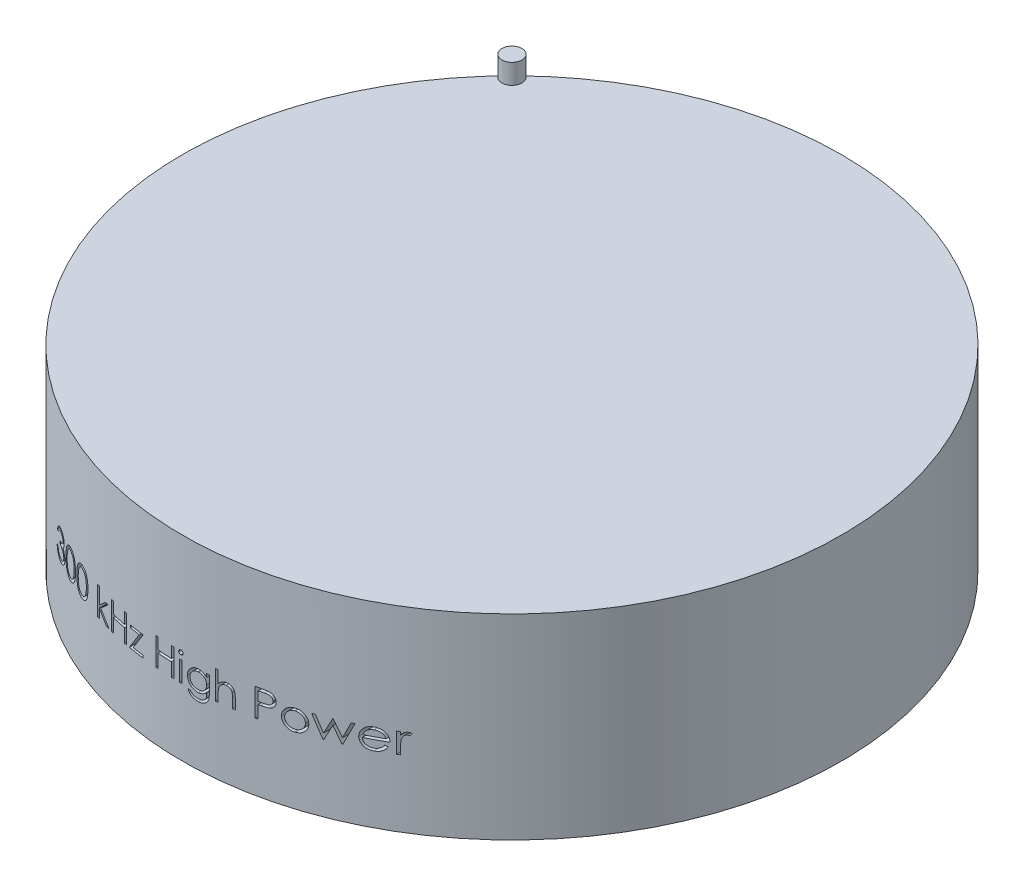
from build123d import *

# Parameters (mm, degrees)
SKETCH1_W          = 41.90000002
SKETCH1_H          = 24.892
SKETCH2_W          = 1.27
SKETCH2_H          = 2.54
CUT_EXTRUDE1_START = 43.18
SKETCH3_W          = 0.314102565
SKETCH3_H          = 2.557692308
CUT_EXTRUDE1_DEPTH = 12.7


with BuildPart() as part:
    # Sketch1 → Revolve1 (revolve)
    with BuildSketch(Plane.XY):
        with Locations((20.95000001, 12.446)):
            Rectangle(SKETCH1_W, SKETCH1_H)
    revolve(axis=Axis((0, 0, 0), (0, 1, 0)))

    # Sketch3 → Cut-Extrude1 (cut)
    # profile 1 of 16: a face of its own
    with BuildSketch(Plane.XY.offset(CUT_EXTRUDE1_START)):
        with BuildLine():
            Line((-21.96474359, 11.216218413), (-22.278846154, 11.216218413))
            add(Edge.make_bspline(
                [(-22.278846154, 11.216218413), (-22.270336603, 11.251450897), (-22.253701128, 11.320327521), (-22.219003554, 11.418734782), (-22.181204299, 11.511858303), (-22.135815194, 11.597954377), (-22.08630644, 11.67875328), (-22.029583719, 11.752422404), (-21.968263996, 11.82083537), (-21.900439047, 11.881548607), (-21.829310385, 11.936526336), (-21.753875765, 11.983401394), (-21.675652872, 12.023725547), (-21.594099739, 12.056945778), (-21.508973567, 12.081971302), (-21.421043944, 12.100128108), (-21.330080444, 12.111919222), (-21.268332853, 12.113069985), (-21.236979167, 12.11365431)],
                knots=[0, 0, 0, 0, 1.162005537, 2.271625781, 3.343758855, 4.383309926, 5.390229558, 6.379919256, 7.361854164, 8.333198761, 9.295911338, 10.242430842, 11.177959212, 12.116337295, 13.062827104, 14.020064771, 14.994644689, 16, 16, 16, 16], degree=3))
            add(Edge.make_bspline(
                [(-21.236979167, 12.11365431), (-21.191296425, 12.11227508), (-21.100927414, 12.109546704), (-20.968164367, 12.084632268), (-20.840137548, 12.045207135), (-20.7182483, 11.990733408), (-20.605029867, 11.923546095), (-20.50429368, 11.843581358), (-20.41740517, 11.752382057), (-20.344510792, 11.651649492), (-20.287435793, 11.543993983), (-20.245349419, 11.433193826), (-20.219727738, 11.319511855), (-20.216407182, 11.242754575), (-20.21474359, 11.204299342)],
                knots=[0, 0, 0, 0, 1.083050992, 2.142477498, 3.193116406, 4.255571735, 5.30263384, 6.308962982, 7.297363603, 8.282367274, 9.249857812, 10.179914175, 11.08814088, 12, 12, 12, 12], degree=3))
            add(Edge.make_bspline(
                [(-20.21474359, 11.204299342), (-20.215907181, 11.167292547), (-20.218184148, 11.094875993), (-20.237517853, 10.989154496), (-20.270054116, 10.889512895), (-20.315123879, 10.795531733), (-20.373465429, 10.707806894), (-20.444138126, 10.626141003), (-20.527640788, 10.550171845), (-20.590919726, 10.506652372), (-20.623497596, 10.484247259)],
                knots=[0, 0, 0, 0, 1.024540389, 2.004866551, 2.965041327, 3.920577974, 4.882998113, 5.874504559, 6.905732034, 8, 8, 8, 8], degree=3))
            add(Edge.make_bspline(
                [(-20.623497596, 10.484247259), (-20.586265842, 10.466269087), (-20.512498967, 10.43064913), (-20.411948438, 10.360793372), (-20.320670562, 10.280137025), (-20.269766843, 10.217194372), (-20.244190705, 10.185569374)],
                knots=[0, 0, 0, 0, 1.015518401, 2.012035669, 3.001164323, 4, 4, 4, 4], degree=3))
            add(Edge.make_bspline(
                [(-20.244190705, 10.185569374), (-20.227349363, 10.162511623), (-20.193942467, 10.116773706), (-20.152706933, 10.04323728), (-20.115297819, 9.968885791), (-20.086147599, 9.891726385), (-20.063573732, 9.812653371), (-20.0474377, 9.731530975), (-20.037413559, 9.648292953), (-20.035978007, 9.591980472), (-20.03525641, 9.563674342)],
                knots=[0, 0, 0, 0, 1.025084078, 2.033381695, 3.024893161, 4.013698104, 4.991890475, 5.976764909, 6.982997093, 8, 8, 8, 8], degree=3))
            add(Edge.make_bspline(
                [(-20.03525641, 9.563674342), (-20.037050924, 9.514664621), (-20.040631506, 9.416875819), (-20.07263558, 9.272401097), (-20.122248821, 9.131175595), (-20.192705757, 8.996100756), (-20.278573266, 8.869720375), (-20.38073059, 8.756644066), (-20.498016998, 8.659445462), (-20.628822647, 8.578235233), (-20.770539776, 8.513317311), (-20.922115368, 8.468259868), (-21.081365421, 8.438913869), (-21.190572719, 8.435767), (-21.24609375, 8.434167131)],
                knots=[0, 0, 0, 0, 0.955779014, 1.907060117, 2.875433937, 3.871313158, 4.872415639, 5.851225146, 6.836215519, 7.83643374, 8.849228613, 9.86973379, 10.916971861, 12, 12, 12, 12], degree=3))
            add(Edge.make_bspline(
                [(-21.24609375, 8.434167131), (-21.28351305, 8.435035344), (-21.357141755, 8.436743698), (-21.465385254, 8.448422299), (-21.568706953, 8.469752304), (-21.667246551, 8.49845561), (-21.761091587, 8.534847352), (-21.849955693, 8.58016605), (-21.934385586, 8.633477552), (-22.013584537, 8.69541114), (-22.087543105, 8.764692479), (-22.154295829, 8.842551489), (-22.214955622, 8.927548893), (-22.267898261, 9.02067195), (-22.315535213, 9.120717207), (-22.35471617, 9.228965705), (-22.389201739, 9.344449727), (-22.405235203, 9.424927467), (-22.413461538, 9.466218413)],
                knots=[0, 0, 0, 0, 1.048658725, 2.063410685, 3.046034179, 4.001477787, 4.936774919, 5.862367409, 6.792675028, 7.730719943, 8.675894397, 9.627829632, 10.600096036, 11.597688215, 12.626045268, 13.701542398, 14.82072376, 16, 16, 16, 16], degree=3))
            Line((-22.413461538, 9.466218413), (-22.099358974, 9.466218413))
            add(Edge.make_bspline(
                [(-22.099358974, 9.466218413), (-22.091175683, 9.439269399), (-22.07525847, 9.386851228), (-22.048164172, 9.311410922), (-22.0172959, 9.242252869), (-21.984181342, 9.178869747), (-21.949402895, 9.120637344), (-21.91048797, 9.069095475), (-21.870318825, 9.021980273), (-21.840039472, 8.995435661), (-21.825220353, 8.982444374)],
                knots=[0, 0, 0, 0, 1.198163088, 2.33053128, 3.407730985, 4.417276592, 5.372219308, 6.28897303, 7.162600585, 8, 8, 8, 8], degree=3))
            add(Edge.make_bspline(
                [(-21.825220353, 8.982444374), (-21.805623776, 8.96733604), (-21.766491113, 8.937166008), (-21.702722882, 8.89866438), (-21.635657996, 8.865303355), (-21.563843322, 8.839819659), (-21.488828551, 8.818241998), (-21.409401186, 8.804121479), (-21.326261969, 8.794433308), (-21.269494205, 8.793578376), (-21.240484776, 8.79314149)],
                knots=[0, 0, 0, 0, 0.946170439, 1.889420265, 2.845303464, 3.807233317, 4.801018734, 5.828864929, 6.890507805, 8, 8, 8, 8], degree=3))
            add(Edge.make_bspline(
                [(-21.240484776, 8.79314149), (-21.207731273, 8.793757395), (-21.143684626, 8.794961744), (-21.050229767, 8.806037451), (-20.961322319, 8.822167865), (-20.877949393, 8.847080847), (-20.799018886, 8.877861699), (-20.725637236, 8.916510104), (-20.65684113, 8.961854826), (-20.593511725, 9.013393985), (-20.536566217, 9.06981548), (-20.486426704, 9.128828551), (-20.443802043, 9.19018438), (-20.409418464, 9.254222501), (-20.382267914, 9.32067773), (-20.363784714, 9.389736559), (-20.350933198, 9.460833826), (-20.349886586, 9.509162795), (-20.349358974, 9.533526105)],
                knots=[0, 0, 0, 0, 1.217147791, 2.380027433, 3.494444702, 4.572153297, 5.609568379, 6.639424714, 7.649109417, 8.668170816, 9.669597737, 10.625200337, 11.543417969, 12.441394052, 13.322311151, 14.205496177, 15.095365482, 16, 16, 16, 16], degree=3))
            add(Edge.make_bspline(
                [(-20.349358974, 9.533526105), (-20.350889276, 9.566137444), (-20.353942264, 9.631197852), (-20.377250844, 9.726915426), (-20.415589708, 9.819138839), (-20.469262219, 9.906294629), (-20.534597948, 9.98707053), (-20.610962855, 10.059142013), (-20.698991083, 10.118612104), (-20.780010952, 10.15970076), (-20.851776109, 10.187737835), (-20.913191493, 10.2064128), (-20.981948097, 10.222226456), (-21.057214445, 10.236938727), (-21.139557662, 10.249460075), (-21.2288881, 10.259901891), (-21.325223861, 10.268256932), (-21.391915027, 10.271988027), (-21.426282051, 10.27391072)],
                knots=[0, 0, 0, 0, 1.07054697, 2.135767047, 3.216561865, 4.33974944, 5.486079747, 6.621378074, 7.775625952, 8.963672916, 9.598146892, 10.304877434, 11.070270905, 11.915000392, 12.823868403, 13.805723172, 14.86925407, 16, 16, 16, 16], degree=3))
            Line((-21.426282051, 10.27391072), (-21.426282051, 10.632885079))
            add(Edge.make_bspline(
                [(-21.426282051, 10.632885079), (-21.382980886, 10.633619883), (-21.298164539, 10.635059183), (-21.174270234, 10.652467193), (-21.055796922, 10.676547821), (-20.94537018, 10.713433014), (-20.844721467, 10.756273311), (-20.757401865, 10.80612552), (-20.684634717, 10.861540269), (-20.626773646, 10.923372879), (-20.583244417, 10.989687926), (-20.55141762, 11.058804584), (-20.532617294, 11.131328645), (-20.530107627, 11.180823313), (-20.528846154, 11.205701586)],
                knots=[0, 0, 0, 0, 1.321986639, 2.589447074, 3.816329219, 5.01088745, 6.139805852, 7.153945165, 8.075214402, 8.924034688, 9.728124013, 10.488707548, 11.240355623, 12, 12, 12, 12], degree=3))
            add(Edge.make_bspline(
                [(-20.528846154, 11.205701586), (-20.529260565, 11.223979331), (-20.530085016, 11.260342038), (-20.540482294, 11.313467107), (-20.556106335, 11.364968053), (-20.577586064, 11.414625863), (-20.606336263, 11.462096137), (-20.640742249, 11.507783586), (-20.681710349, 11.551427365), (-20.728655796, 11.592107684), (-20.779067601, 11.630876921), (-20.834317376, 11.663790558), (-20.892739251, 11.69193562), (-20.954397906, 11.715145122), (-21.019493436, 11.732604411), (-21.087719994, 11.745140252), (-21.159207677, 11.752977907), (-21.207979409, 11.754106323), (-21.232772436, 11.754679951)],
                knots=[0, 0, 0, 0, 0.884392785, 1.759457502, 2.611959086, 3.489218968, 4.37281399, 5.2945488, 6.255912374, 7.266815255, 8.301784654, 9.332968512, 10.37626691, 11.440494194, 12.520033166, 13.637162961, 14.798855837, 16, 16, 16, 16], degree=3))
            add(Edge.make_bspline(
                [(-21.232772436, 11.754679951), (-21.272624104, 11.753288589), (-21.35046368, 11.750570935), (-21.462678597, 11.726767922), (-21.566997931, 11.688789839), (-21.646736598, 11.643456819), (-21.705619172, 11.598706385), (-21.74769611, 11.559623999), (-21.789016621, 11.516191175), (-21.826862297, 11.4657328), (-21.865136274, 11.41166601), (-21.899980836, 11.351242328), (-21.933840528, 11.286037934), (-21.954243077, 11.239942299), (-21.96474359, 11.216218413)],
                knots=[0, 0, 0, 0, 1.472543308, 2.876219568, 4.221790263, 5.565193594, 6.249813518, 6.953379497, 7.687249741, 8.463570142, 9.283606569, 10.136032583, 11.040678096, 12, 12, 12, 12], degree=3))
        make_face()
    # profile 2 of 16: a face of its own
    with BuildSketch(Plane.XY.offset(CUT_EXTRUDE1_START)):
        with BuildLine():
            add(Edge.make_bspline(
                [(-19.721153846, 10.272508477), (-19.720825828, 10.328605864), (-19.720188648, 10.437575849), (-19.713100227, 10.596360491), (-19.701324885, 10.74532078), (-19.685187512, 10.884463846), (-19.665549532, 11.01382561), (-19.639334045, 11.133060367), (-19.609521242, 11.242719974), (-19.574968797, 11.343162023), (-19.535981008, 11.435739726), (-19.493546747, 11.522164927), (-19.445981952, 11.602306859), (-19.39600504, 11.67744465), (-19.341592968, 11.746348344), (-19.284294177, 11.809991007), (-19.221872301, 11.866901757), (-19.156449293, 11.91874806), (-19.087432829, 11.964197531), (-19.016790162, 12.00423027), (-18.944035057, 12.038430137), (-18.868968874, 12.065320573), (-18.792266316, 12.08753142), (-18.713659249, 12.102720368), (-18.633017885, 12.112277276), (-18.57858645, 12.113190944), (-18.550981571, 12.11365431)],
                knots=[0, 0, 0, 0, 1.646270934, 3.197905019, 4.663502075, 6.030701355, 7.308322542, 8.50163776, 9.611534131, 10.641858119, 11.616356847, 12.558055219, 13.465016945, 14.349605745, 15.204443733, 16.039544428, 16.859896111, 17.680448484, 18.487036065, 19.28249412, 20.06191084, 20.843045899, 21.620316918, 22.403196591, 23.190181807, 24, 24, 24, 24], degree=3))
            add(Edge.make_bspline(
                [(-18.550981571, 12.11365431), (-18.523146092, 12.113166495), (-18.467790083, 12.112196384), (-18.385949708, 12.102872441), (-18.306000026, 12.087401318), (-18.228281887, 12.065480344), (-18.152156901, 12.038284667), (-18.078220493, 12.00419755), (-18.006013412, 11.964518683), (-17.936683124, 11.917894805), (-17.869468509, 11.865912529), (-17.806020546, 11.80714986), (-17.74633346, 11.742200141), (-17.689658155, 11.671758277), (-17.637602557, 11.594473192), (-17.588029125, 11.511689083), (-17.543657089, 11.421958218), (-17.500922414, 11.32677775), (-17.464035427, 11.223514091), (-17.430769182, 11.112749331), (-17.403890213, 10.993175144), (-17.381500941, 10.865418898), (-17.364156045, 10.729011415), (-17.351523403, 10.5842451), (-17.344850318, 10.431024709), (-17.343593617, 10.32626686), (-17.342948718, 10.272508477)],
                knots=[0, 0, 0, 0, 0.810914788, 1.612654377, 2.396697861, 3.181598691, 3.963628158, 4.749916497, 5.551656086, 6.361998678, 7.18212741, 8.025565596, 8.878627764, 9.750805457, 10.657531673, 11.591944965, 12.560506719, 13.57287815, 14.630710178, 15.753379473, 16.941251878, 18.199788006, 19.531962791, 20.947069417, 22.433333509, 24, 24, 24, 24], degree=3))
            add(Edge.make_bspline(
                [(-17.342948718, 10.272508477), (-17.343600302, 10.218984569), (-17.344869888, 10.114695417), (-17.351448595, 9.962164442), (-17.364407226, 9.818166398), (-17.380617215, 9.682355936), (-17.403068178, 9.555298317), (-17.430673344, 9.436553869), (-17.461323667, 9.325609797), (-17.499158461, 9.223374985), (-17.540569171, 9.128423262), (-17.585624367, 9.039756114), (-17.633894193, 8.956589821), (-17.686482938, 8.879590074), (-17.742536352, 8.808211417), (-17.80325414, 8.743713795), (-17.866924726, 8.684543123), (-17.934337141, 8.631891495), (-18.004748693, 8.585806691), (-18.07670777, 8.54459284), (-18.151491153, 8.511360145), (-18.227404106, 8.482825104), (-18.305532472, 8.461024652), (-18.385778862, 8.445950797), (-18.467735098, 8.435378948), (-18.523136663, 8.434572468), (-18.550981571, 8.434167131)],
                knots=[0, 0, 0, 0, 1.561518951, 3.042555995, 4.452378317, 5.7783523, 7.031515105, 8.214008947, 9.334062868, 10.386615937, 11.391082383, 12.354592575, 13.286541444, 14.194233754, 15.072674879, 15.931287219, 16.775624067, 17.606195743, 18.42308326, 19.229000347, 20.022332153, 20.807536673, 21.593273796, 22.3848459, 23.188221202, 24, 24, 24, 24], degree=3))
            add(Edge.make_bspline(
                [(-18.550981571, 8.434167131), (-18.578585684, 8.434633486), (-18.633015609, 8.435553048), (-18.713668035, 8.445066779), (-18.791950478, 8.460362283), (-18.868249232, 8.481778887), (-18.942955747, 8.507993723), (-19.015052034, 8.542147407), (-19.085339718, 8.581481476), (-19.153631274, 8.626276897), (-19.218643435, 8.67759858), (-19.28074204, 8.734362869), (-19.338367059, 8.79798628), (-19.392001155, 8.867464203), (-19.442975243, 8.942157446), (-19.489864616, 9.023085819), (-19.53323547, 9.109928429), (-19.572878961, 9.20324634), (-19.608027624, 9.304401268), (-19.639075333, 9.414550446), (-19.66358949, 9.534666082), (-19.684572445, 9.663783449), (-19.701496828, 9.80245738), (-19.713051154, 9.950763158), (-19.720192469, 10.108608367), (-19.720827539, 10.216878141), (-19.721153846, 10.272508477)],
                knots=[0, 0, 0, 0, 0.810891512, 1.598919785, 2.382837074, 3.152667961, 3.926044502, 4.706494248, 5.493654104, 6.291793342, 7.103789334, 7.925228297, 8.761435821, 9.622817696, 10.50288917, 11.416980706, 12.369136599, 13.353924996, 14.394355917, 15.514179734, 16.714354668, 17.994756427, 19.357759367, 20.818452758, 22.365282078, 24, 24, 24, 24], degree=3))
        make_face()
        with BuildLine():
            add(Edge.make_bspline(
                [(-19.407051282, 10.27391072), (-19.406931835, 10.227162021), (-19.406700012, 10.136431977), (-19.400643811, 10.004588716), (-19.392393579, 9.881618387), (-19.381752282, 9.76736485), (-19.365949333, 9.662214838), (-19.348242546, 9.565445155), (-19.326694456, 9.477567918), (-19.301199438, 9.397980107), (-19.272160341, 9.325331039), (-19.240454478, 9.257729823), (-19.206393755, 9.194377887), (-19.168274604, 9.135844279), (-19.126759541, 9.081938115), (-19.082786282, 9.031705282), (-19.034713697, 8.986908301), (-18.968209955, 8.933181446), (-18.88041348, 8.877662312), (-18.769793025, 8.829316222), (-18.656124574, 8.798933766), (-18.578973324, 8.79507001), (-18.540464744, 8.79314149)],
                knots=[0, 0, 0, 0, 1.459021318, 2.831673884, 4.118529203, 5.306027144, 6.411944654, 7.436330062, 8.375795394, 9.233974572, 10.042671642, 10.816086306, 11.563610507, 12.285937304, 12.993564865, 13.685989202, 14.367179055, 15.041617293, 16.353048772, 17.594441528, 18.799311195, 20, 20, 20, 20], degree=3))
            add(Edge.make_bspline(
                [(-18.540464744, 8.79314149), (-18.501707072, 8.79473927), (-18.424271749, 8.797931533), (-18.311137954, 8.82873027), (-18.201307684, 8.87519981), (-18.115235743, 8.930147315), (-18.0497532, 8.982475645), (-18.00283621, 9.027090293), (-17.959774161, 9.07704616), (-17.918932086, 9.130945456), (-17.881473011, 9.189817941), (-17.847409873, 9.253380516), (-17.816326525, 9.321809694), (-17.798617479, 9.369579433), (-17.789563301, 9.394002868)],
                knots=[0, 0, 0, 0, 1.353760809, 2.704726607, 4.075137775, 5.516104923, 6.260822281, 7.007110065, 7.778089737, 8.566572457, 9.372053459, 10.217411131, 11.088608312, 12, 12, 12, 12], degree=3))
            add(Edge.make_bspline(
                [(-17.789563301, 9.394002868), (-17.779011533, 9.425232607), (-17.75758692, 9.488642371), (-17.729975145, 9.587006024), (-17.708229746, 9.690208787), (-17.68866638, 9.797633904), (-17.675313325, 9.910073605), (-17.664565511, 10.027179989), (-17.658234824, 10.149041351), (-17.657450073, 10.231836343), (-17.657051282, 10.27391072)],
                knots=[0, 0, 0, 0, 0.884706709, 1.796334032, 2.740027952, 3.714592787, 4.726048262, 5.777819803, 6.87074269, 8, 8, 8, 8], degree=3))
            add(Edge.make_bspline(
                [(-17.657051282, 10.27391072), (-17.657601471, 10.315978293), (-17.658677759, 10.398271458), (-17.662791747, 10.518789638), (-17.673415321, 10.633257399), (-17.68521444, 10.742167872), (-17.702611661, 10.844918175), (-17.721369468, 10.94236848), (-17.74657068, 11.033311505), (-17.773490455, 11.119171086), (-17.804300851, 11.198971741), (-17.838216585, 11.273085527), (-17.874438344, 11.341870252), (-17.913780584, 11.405137193), (-17.955776267, 11.463169736), (-18.001533817, 11.514804331), (-18.049238189, 11.561641299), (-18.116055375, 11.615103868), (-18.203529665, 11.669615564), (-18.312375312, 11.719781324), (-18.425645957, 11.748589616), (-18.502219411, 11.752651303), (-18.540464744, 11.754679951)],
                knots=[0, 0, 0, 0, 1.31362396, 2.569729283, 3.763502607, 4.902122613, 5.988968491, 7.01645872, 7.998833611, 8.933434873, 9.825090667, 10.667526885, 11.477055099, 12.250526234, 12.991942729, 13.710640831, 14.402115721, 15.076753259, 16.378508321, 17.609869233, 18.806226677, 20, 20, 20, 20], degree=3))
            add(Edge.make_bspline(
                [(-18.540464744, 11.754679951), (-18.579175336, 11.752648504), (-18.656667041, 11.74858191), (-18.771114996, 11.719888657), (-18.880819348, 11.669875691), (-18.968062322, 11.614923318), (-19.034926109, 11.562585007), (-19.082008802, 11.517198553), (-19.126154974, 11.467552298), (-19.166822675, 11.413150384), (-19.204911958, 11.354685016), (-19.23989297, 11.291696252), (-19.2714103, 11.223864887), (-19.300494836, 11.151248452), (-19.326067624, 11.071667507), (-19.347161587, 10.983898514), (-19.366648641, 10.887436622), (-19.380443909, 10.781717114), (-19.392707665, 10.667434961), (-19.400589013, 10.544157643), (-19.406720271, 10.412093262), (-19.406938735, 10.320894104), (-19.407051282, 10.27391072)],
                knots=[0, 0, 0, 0, 1.207732386, 2.417664972, 3.655092373, 4.956220595, 5.625982001, 6.301752483, 6.994047911, 7.697131622, 8.419323945, 9.170223765, 9.943494443, 10.752040957, 11.610060368, 12.549350801, 13.567764191, 14.679664412, 15.874934091, 17.154273443, 18.533957287, 20, 20, 20, 20], degree=3))
        make_face(mode=Mode.SUBTRACT)
    # profile 3 of 16: a face of its own
    with BuildSketch(Plane.XY.offset(CUT_EXTRUDE1_START)):
        with BuildLine():
            add(Edge.make_bspline(
                [(-17.028846154, 10.272508477), (-17.028518136, 10.328605864), (-17.027880956, 10.437575849), (-17.020792535, 10.596360491), (-17.009017192, 10.74532078), (-16.99287982, 10.884463846), (-16.973241839, 11.01382561), (-16.947026353, 11.133060367), (-16.91721355, 11.242719974), (-16.882661104, 11.343162023), (-16.843673315, 11.435739726), (-16.801239055, 11.522164927), (-16.75367426, 11.602306859), (-16.703697347, 11.67744465), (-16.649285276, 11.746348344), (-16.591986485, 11.809991007), (-16.529564609, 11.866901757), (-16.464141601, 11.91874806), (-16.395125136, 11.964197531), (-16.32448247, 12.00423027), (-16.251727364, 12.038430137), (-16.176661181, 12.065320573), (-16.099958623, 12.08753142), (-16.021351557, 12.102720368), (-15.940710193, 12.112277276), (-15.886278758, 12.113190944), (-15.858673878, 12.11365431)],
                knots=[0, 0, 0, 0, 1.646270934, 3.197905019, 4.663502075, 6.030701355, 7.308322542, 8.50163776, 9.611534131, 10.641858119, 11.616356847, 12.558055219, 13.465016945, 14.349605745, 15.204443733, 16.039544428, 16.859896111, 17.680448484, 18.487036065, 19.28249412, 20.06191084, 20.843045899, 21.620316918, 22.403196591, 23.190181807, 24, 24, 24, 24], degree=3))
            add(Edge.make_bspline(
                [(-15.858673878, 12.11365431), (-15.8308384, 12.113166495), (-15.775482391, 12.112196384), (-15.693642016, 12.102872441), (-15.613692334, 12.087401318), (-15.535974195, 12.065480344), (-15.459849209, 12.038284667), (-15.385912801, 12.00419755), (-15.313705719, 11.964518683), (-15.244375432, 11.917894805), (-15.177160817, 11.865912529), (-15.113712854, 11.80714986), (-15.054025768, 11.742200141), (-14.997350462, 11.671758277), (-14.945294865, 11.594473192), (-14.895721433, 11.511689083), (-14.851349397, 11.421958218), (-14.808614722, 11.32677775), (-14.771727735, 11.223514091), (-14.73846149, 11.112749331), (-14.711582521, 10.993175144), (-14.689193249, 10.865418898), (-14.671848353, 10.729011415), (-14.659215711, 10.5842451), (-14.652542626, 10.431024709), (-14.651285925, 10.32626686), (-14.650641026, 10.272508477)],
                knots=[0, 0, 0, 0, 0.810914788, 1.612654377, 2.396697861, 3.181598691, 3.963628158, 4.749916497, 5.551656086, 6.361998678, 7.18212741, 8.025565596, 8.878627764, 9.750805457, 10.657531673, 11.591944965, 12.560506719, 13.57287815, 14.630710178, 15.753379473, 16.941251878, 18.199788006, 19.531962791, 20.947069417, 22.433333509, 24, 24, 24, 24], degree=3))
            add(Edge.make_bspline(
                [(-14.650641026, 10.272508477), (-14.65129261, 10.218984569), (-14.652562196, 10.114695417), (-14.659140903, 9.962164442), (-14.672099534, 9.818166398), (-14.688309522, 9.682355936), (-14.710760485, 9.555298317), (-14.738365652, 9.436553869), (-14.769015974, 9.325609797), (-14.806850769, 9.223374985), (-14.848261479, 9.128423262), (-14.893316675, 9.039756114), (-14.941586501, 8.956589821), (-14.994175246, 8.879590074), (-15.050228659, 8.808211417), (-15.110946448, 8.743713795), (-15.174617033, 8.684543123), (-15.242029449, 8.631891495), (-15.312441, 8.585806691), (-15.384400077, 8.54459284), (-15.459183461, 8.511360145), (-15.535096413, 8.482825104), (-15.613224779, 8.461024652), (-15.69347117, 8.445950797), (-15.775427406, 8.435378948), (-15.830828971, 8.434572468), (-15.858673878, 8.434167131)],
                knots=[0, 0, 0, 0, 1.561518951, 3.042555995, 4.452378317, 5.7783523, 7.031515105, 8.214008947, 9.334062868, 10.386615937, 11.391082383, 12.354592575, 13.286541444, 14.194233754, 15.072674879, 15.931287219, 16.775624067, 17.606195743, 18.42308326, 19.229000347, 20.022332153, 20.807536673, 21.593273796, 22.3848459, 23.188221202, 24, 24, 24, 24], degree=3))
            add(Edge.make_bspline(
                [(-15.858673878, 8.434167131), (-15.886277992, 8.434633486), (-15.940707917, 8.435553048), (-16.021360342, 8.445066779), (-16.099642786, 8.460362283), (-16.17594154, 8.481778887), (-16.250648055, 8.507993723), (-16.322744342, 8.542147407), (-16.393032025, 8.581481476), (-16.461323581, 8.626276897), (-16.526335742, 8.67759858), (-16.588434348, 8.734362869), (-16.646059367, 8.79798628), (-16.699693462, 8.867464203), (-16.750667551, 8.942157446), (-16.797556924, 9.023085819), (-16.840927778, 9.109928429), (-16.880571269, 9.20324634), (-16.915719932, 9.304401268), (-16.94676764, 9.414550446), (-16.971281798, 9.534666082), (-16.992264753, 9.663783449), (-17.009189136, 9.80245738), (-17.020743461, 9.950763158), (-17.027884776, 10.108608367), (-17.028519847, 10.216878141), (-17.028846154, 10.272508477)],
                knots=[0, 0, 0, 0, 0.810891512, 1.598919785, 2.382837074, 3.152667961, 3.926044502, 4.706494248, 5.493654104, 6.291793342, 7.103789334, 7.925228297, 8.761435821, 9.622817696, 10.50288917, 11.416980706, 12.369136599, 13.353924996, 14.394355917, 15.514179734, 16.714354668, 17.994756427, 19.357759367, 20.818452758, 22.365282078, 24, 24, 24, 24], degree=3))
        make_face()
        with BuildLine():
            add(Edge.make_bspline(
                [(-16.71474359, 10.27391072), (-16.714624143, 10.227162021), (-16.714392319, 10.136431977), (-16.708336119, 10.004588716), (-16.700085887, 9.881618387), (-16.68944459, 9.76736485), (-16.673641641, 9.662214838), (-16.655934853, 9.565445155), (-16.634386764, 9.477567918), (-16.608891746, 9.397980107), (-16.579852649, 9.325331039), (-16.548146785, 9.257729823), (-16.514086062, 9.194377887), (-16.475966912, 9.135844279), (-16.434451849, 9.081938115), (-16.390478589, 9.031705282), (-16.342406005, 8.986908301), (-16.275902263, 8.933181446), (-16.188105788, 8.877662312), (-16.077485333, 8.829316222), (-15.963816882, 8.798933766), (-15.886665632, 8.79507001), (-15.848157051, 8.79314149)],
                knots=[0, 0, 0, 0, 1.459021318, 2.831673884, 4.118529203, 5.306027144, 6.411944654, 7.436330062, 8.375795394, 9.233974572, 10.042671642, 10.816086306, 11.563610507, 12.285937304, 12.993564865, 13.685989202, 14.367179055, 15.041617293, 16.353048772, 17.594441528, 18.799311195, 20, 20, 20, 20], degree=3))
            add(Edge.make_bspline(
                [(-15.848157051, 8.79314149), (-15.80939938, 8.79473927), (-15.731964056, 8.797931533), (-15.618830261, 8.82873027), (-15.508999991, 8.87519981), (-15.422928051, 8.930147315), (-15.357445507, 8.982475645), (-15.310528517, 9.027090293), (-15.267466469, 9.07704616), (-15.226624394, 9.130945456), (-15.189165318, 9.189817941), (-15.155102181, 9.253380516), (-15.124018833, 9.321809694), (-15.106309787, 9.369579433), (-15.097255609, 9.394002868)],
                knots=[0, 0, 0, 0, 1.353760809, 2.704726607, 4.075137775, 5.516104923, 6.260822281, 7.007110065, 7.778089737, 8.566572457, 9.372053459, 10.217411131, 11.088608312, 12, 12, 12, 12], degree=3))
            add(Edge.make_bspline(
                [(-15.097255609, 9.394002868), (-15.086703841, 9.425232607), (-15.065279227, 9.488642371), (-15.037667453, 9.587006024), (-15.015922054, 9.690208787), (-14.996358688, 9.797633904), (-14.983005632, 9.910073605), (-14.972257819, 10.027179989), (-14.965927132, 10.149041351), (-14.965142381, 10.231836343), (-14.96474359, 10.27391072)],
                knots=[0, 0, 0, 0, 0.884706709, 1.796334032, 2.740027952, 3.714592787, 4.726048262, 5.777819803, 6.87074269, 8, 8, 8, 8], degree=3))
            add(Edge.make_bspline(
                [(-14.96474359, 10.27391072), (-14.965293779, 10.315978293), (-14.966370067, 10.398271458), (-14.970484054, 10.518789638), (-14.981107629, 10.633257399), (-14.992906748, 10.742167872), (-15.010303969, 10.844918175), (-15.029061776, 10.94236848), (-15.054262988, 11.033311505), (-15.081182763, 11.119171086), (-15.111993159, 11.198971741), (-15.145908893, 11.273085527), (-15.182130652, 11.341870252), (-15.221472892, 11.405137193), (-15.263468575, 11.463169736), (-15.309226124, 11.514804331), (-15.356930497, 11.561641299), (-15.423747683, 11.615103868), (-15.511221973, 11.669615564), (-15.62006762, 11.719781324), (-15.733338264, 11.748589616), (-15.809911718, 11.752651303), (-15.848157051, 11.754679951)],
                knots=[0, 0, 0, 0, 1.31362396, 2.569729283, 3.763502607, 4.902122613, 5.988968491, 7.01645872, 7.998833611, 8.933434873, 9.825090667, 10.667526885, 11.477055099, 12.250526234, 12.991942729, 13.710640831, 14.402115721, 15.076753259, 16.378508321, 17.609869233, 18.806226677, 20, 20, 20, 20], degree=3))
            add(Edge.make_bspline(
                [(-15.848157051, 11.754679951), (-15.886867643, 11.752648504), (-15.964359349, 11.74858191), (-16.078807304, 11.719888657), (-16.188511655, 11.669875691), (-16.27575463, 11.614923318), (-16.342618417, 11.562585007), (-16.38970111, 11.517198553), (-16.433847282, 11.467552298), (-16.474514982, 11.413150384), (-16.512604265, 11.354685016), (-16.547585278, 11.291696252), (-16.579102608, 11.223864887), (-16.608187144, 11.151248452), (-16.633759932, 11.071667507), (-16.654853895, 10.983898514), (-16.674340948, 10.887436622), (-16.688136217, 10.781717114), (-16.700399973, 10.667434961), (-16.708281321, 10.544157643), (-16.714412578, 10.412093262), (-16.714631043, 10.320894104), (-16.71474359, 10.27391072)],
                knots=[0, 0, 0, 0, 1.207732386, 2.417664972, 3.655092373, 4.956220595, 5.625982001, 6.301752483, 6.994047911, 7.697131622, 8.419323945, 9.170223765, 9.943494443, 10.752040957, 11.610060368, 12.549350801, 13.567764191, 14.679664412, 15.874934091, 17.154273443, 18.533957287, 20, 20, 20, 20], degree=3))
        make_face(mode=Mode.SUBTRACT)
    # profile 4 of 16: a face of its own
    with BuildSketch(Plane.XY.offset(CUT_EXTRUDE1_START)):
        Polygon((-12.766025641, 12.11365431), (-12.451923077, 12.11365431), (-12.451923077, 10.038333797), (-11.288060897, 11.081603028), (-10.836538462, 11.081603028), (-12.186899038, 9.870064566), (-10.701923077, 8.52391072), (-11.152744391, 8.52391072), (-12.451923077, 9.702496457), (-12.451923077, 8.52391072), (-12.766025641, 8.52391072), align=None)
    # profile 5 of 16: a face of its own
    with BuildSketch(Plane.XY.offset(CUT_EXTRUDE1_START)):
        Polygon((-10.253205128, 12.02391072), (-9.939102564, 12.02391072), (-9.939102564, 10.588013284), (-8.144230769, 10.588013284), (-8.144230769, 12.02391072), (-7.830128205, 12.02391072), (-7.830128205, 8.52391072), (-8.144230769, 8.52391072), (-8.144230769, 10.229038925), (-9.939102564, 10.229038925), (-9.939102564, 8.52391072), (-10.253205128, 8.52391072), align=None)
    # profile 6 of 16: a face of its own
    with BuildSketch(Plane.XY.offset(CUT_EXTRUDE1_START)):
        Polygon((-7.246794872, 11.081603028), (-5.317307692, 11.081603028), (-6.805088141, 8.838013284), (-5.362179487, 8.838013284), (-5.362179487, 8.52391072), (-7.381410256, 8.52391072), (-5.892928686, 10.767500464), (-7.246794872, 10.767500464), align=None)
    # profile 7 of 16: a face of its own
    with BuildSketch(Plane.XY.offset(CUT_EXTRUDE1_START)):
        Polygon((-3.522435897, 12.02391072), (-3.208333333, 12.02391072), (-3.208333333, 10.588013284), (-1.413461538, 10.588013284), (-1.413461538, 12.02391072), (-1.099358974, 12.02391072), (-1.099358974, 8.52391072), (-1.413461538, 8.52391072), (-1.413461538, 10.229038925), (-3.208333333, 10.229038925), (-3.208333333, 8.52391072), (-3.522435897, 8.52391072), align=None)
    # profile 8 of 16: a face of its own
    with BuildSketch(Plane.XY.offset(CUT_EXTRUDE1_START)):
        with BuildLine():
            add(Edge.make_bspline(
                [(-0.180889423, 12.158526105), (-0.161398107, 12.157621952), (-0.123230367, 12.155851448), (-0.0680371, 12.140689971), (-0.017780088, 12.114990286), (0.026797645, 12.080510605), (0.065049532, 12.039961162), (0.091830242, 11.992700193), (0.109042638, 11.941641554), (0.111121194, 11.906026465), (0.112179487, 11.887893092)],
                knots=[0, 0, 0, 0, 1.055194115, 2.066272739, 3.074728998, 4.095836921, 5.109056067, 6.073838105, 7.019297344, 8, 8, 8, 8], degree=3))
            add(Edge.make_bspline(
                [(0.112179487, 11.887893092), (0.111097327, 11.870230439), (0.108958025, 11.835313464), (0.091843537, 11.785139992), (0.064821299, 11.738535708), (0.026822174, 11.698064998), (-0.017786587, 11.663604378), (-0.068035373, 11.637899639), (-0.123230822, 11.622739502), (-0.161398261, 11.620968813), (-0.180889423, 11.620064566)],
                knots=[0, 0, 0, 0, 0.96129708, 1.900370562, 2.859976407, 3.87933698, 4.906634145, 5.921202961, 6.938410037, 8, 8, 8, 8], degree=3))
            add(Edge.make_bspline(
                [(-0.180889423, 11.620064566), (-0.200157698, 11.620934287), (-0.237660878, 11.622627083), (-0.292027721, 11.638197101), (-0.34185621, 11.663613174), (-0.386520883, 11.697839359), (-0.423751076, 11.738784257), (-0.450849401, 11.78511155), (-0.467924363, 11.835320705), (-0.470068992, 11.870232871), (-0.471153846, 11.887893092)],
                knots=[0, 0, 0, 0, 1.054934014, 2.053291228, 3.073705704, 4.106921865, 5.123545215, 6.088680038, 7.033164197, 8, 8, 8, 8], degree=3))
            add(Edge.make_bspline(
                [(-0.471153846, 11.887893092), (-0.47009276, 11.906023942), (-0.468008718, 11.941634074), (-0.450836602, 11.992729107), (-0.423976795, 12.039710609), (-0.386496231, 12.080736108), (-0.341862771, 12.114981543), (-0.292026026, 12.140392525), (-0.237661326, 12.155963864), (-0.20015785, 12.157656478), (-0.180889423, 12.158526105)],
                knots=[0, 0, 0, 0, 0.98631895, 1.937192651, 2.907499808, 3.917963147, 4.944918757, 5.95915025, 6.951458133, 8, 8, 8, 8], degree=3))
        make_face()
    # profile 9 of 16: a face of its own
    with BuildSketch(Plane.XY.offset(CUT_EXTRUDE1_START)):
        with Locations((-0.17948718, 9.802756874)):
            Rectangle(SKETCH3_W, SKETCH3_H)
    # profile 10 of 16: a face of its own
    with BuildSketch(Plane.XY.offset(CUT_EXTRUDE1_START)):
        with BuildLine():
            Line((2.983974359, 11.081603028), (3.298076923, 11.081603028))
            Line((3.298076923, 11.081603028), (3.298076923, 9.051855432))
            add(Edge.make_bspline(
                [(3.298076923, 9.051855432), (3.297799881, 9.008617837), (3.297265122, 8.925158865), (3.29341415, 8.804480585), (3.285293473, 8.693014499), (3.276084792, 8.590252241), (3.262838075, 8.496670131), (3.246661708, 8.411988926), (3.228426029, 8.336127364), (3.212405812, 8.289402523), (3.204827724, 8.267300143)],
                knots=[0, 0, 0, 0, 1.307562039, 2.523909702, 3.650326591, 4.686913197, 5.643429486, 6.506965704, 7.293745905, 8, 8, 8, 8], degree=3))
            add(Edge.make_bspline(
                [(3.204827724, 8.267300143), (3.193638486, 8.238570222), (3.171594559, 8.181969385), (3.130308926, 8.101735064), (3.084075022, 8.026188674), (3.031268271, 7.955751223), (2.972127467, 7.89077631), (2.908045975, 7.829852311), (2.837775784, 7.774268144), (2.761357072, 7.724982846), (2.680551438, 7.680595792), (2.595405336, 7.642149225), (2.506398898, 7.608662381), (2.412696006, 7.583579586), (2.315765772, 7.561844865), (2.214468341, 7.547700179), (2.109395544, 7.538073121), (2.037950164, 7.537182888), (2.001702724, 7.536731233)],
                knots=[0, 0, 0, 0, 0.981931301, 1.934503488, 2.87077864, 3.801706999, 4.735015492, 5.667491629, 6.616593066, 7.585388521, 8.561939025, 9.551802639, 10.560317337, 11.588439944, 12.640189604, 13.723962949, 14.845264515, 16, 16, 16, 16], degree=3))
            add(Edge.make_bspline(
                [(2.001702724, 7.536731233), (1.94881799, 7.537587719), (1.845519895, 7.539260666), (1.694914902, 7.558751581), (1.551880182, 7.586305954), (1.418305725, 7.628011382), (1.295035628, 7.679048371), (1.182911753, 7.737643324), (1.082940645, 7.804832633), (0.992816972, 7.881333234), (0.911475382, 7.972296916), (0.834948092, 8.07949576), (0.76128715, 8.204562649), (0.718118512, 8.296355362), (0.695512821, 8.344423541)],
                knots=[0, 0, 0, 0, 1.157897085, 2.2616841, 3.32207898, 4.345638746, 5.321241055, 6.241986252, 7.112515963, 7.955008012, 8.825025602, 9.77857164, 10.836726669, 12, 12, 12, 12], degree=3))
            Line((0.695512821, 8.344423541), (1.009615385, 8.344423541))
            add(Edge.make_bspline(
                [(1.009615385, 8.344423541), (1.034877594, 8.304317665), (1.084262102, 8.225915617), (1.176610583, 8.124402461), (1.27781691, 8.037649096), (1.391296593, 7.967738322), (1.517521808, 7.91502853), (1.656568494, 7.877453234), (1.809568116, 7.854956967), (1.91608633, 7.852245673), (1.971554487, 7.850833797)],
                knots=[0, 0, 0, 0, 0.997731894, 1.950442991, 2.880492273, 3.800895997, 4.748200782, 5.754801363, 6.83083817, 8, 8, 8, 8], degree=3))
            add(Edge.make_bspline(
                [(1.971554487, 7.850833797), (2.026321378, 7.852263946), (2.13190646, 7.85502113), (2.283737629, 7.877463274), (2.422332567, 7.915036708), (2.546892768, 7.967645094), (2.655948536, 8.0320955), (2.749960528, 8.104095575), (2.826105204, 8.185276578), (2.877318171, 8.260058384), (2.909152788, 8.326682514), (2.929425025, 8.38403511), (2.945898994, 8.448887987), (2.959678832, 8.521023723), (2.971049745, 8.600545381), (2.978252628, 8.687634784), (2.983458439, 8.782094006), (2.983798409, 8.847587144), (2.983974359, 8.881482836)],
                knots=[0, 0, 0, 0, 1.570740765, 3.028230971, 4.391408896, 5.680370741, 6.894727393, 8.017376726, 9.065722033, 10.075533815, 10.603371122, 11.180248986, 11.817768598, 12.521299649, 13.286540596, 14.121245857, 15.027658897, 16, 16, 16, 16], degree=3))
            Line((2.983974359, 8.881482836), (2.983974359, 9.013994855))
            add(Edge.make_bspline(
                [(2.983974359, 9.013994855), (2.952093242, 8.976053053), (2.888891786, 8.900836833), (2.779744459, 8.802275196), (2.660527543, 8.717389066), (2.531444001, 8.647770432), (2.395655759, 8.592089007), (2.254633528, 8.553146046), (2.109641473, 8.527986146), (2.011389323, 8.52527883), (1.961738782, 8.52391072)],
                knots=[0, 0, 0, 0, 1.012485704, 2.007162095, 2.997754123, 3.998611389, 4.999708251, 5.992315798, 6.98544096, 8, 8, 8, 8], degree=3))
            add(Edge.make_bspline(
                [(1.961738782, 8.52391072), (1.932502513, 8.524425747), (1.874375955, 8.525449705), (1.788021208, 8.534408482), (1.70294077, 8.547407225), (1.619333066, 8.566488664), (1.537077453, 8.59098039), (1.456309861, 8.621597129), (1.376376334, 8.656212247), (1.298729836, 8.696985051), (1.224143706, 8.742347357), (1.15318052, 8.791486248), (1.086211981, 8.844144536), (1.023875492, 8.900841476), (0.96625282, 8.961495009), (0.912568952, 9.025458562), (0.863711605, 9.093625303), (0.818678216, 9.164752261), (0.779620666, 9.239313185), (0.745336294, 9.31569128), (0.715526889, 9.393723235), (0.691761487, 9.473670297), (0.673610374, 9.555482066), (0.660100147, 9.639024515), (0.652437215, 9.724554903), (0.651242291, 9.782176252), (0.650641026, 9.811170336)],
                knots=[0, 0, 0, 0, 1.028754217, 2.045334182, 3.052854819, 4.056607503, 5.061168794, 6.071104265, 7.095078842, 8.125279047, 9.155117945, 10.165957491, 11.161587969, 12.151493252, 13.128948131, 14.104219989, 15.088194871, 16.07871515, 17.064853787, 18.047899887, 19.02414258, 20.002704429, 20.980574569, 21.971845993, 22.979467364, 24, 24, 24, 24], degree=3))
            add(Edge.make_bspline(
                [(0.650641026, 9.811170336), (0.651160192, 9.840173432), (0.652196514, 9.89806729), (0.661147493, 9.983946676), (0.673915682, 10.068676111), (0.694123451, 10.151382253), (0.718445974, 10.233007005), (0.748569547, 10.312947461), (0.784788306, 10.39122797), (0.825798056, 10.467906502), (0.871882148, 10.541954116), (0.922414629, 10.612280762), (0.977456503, 10.678368934), (1.036248419, 10.740885356), (1.099508236, 10.799226849), (1.167203228, 10.853251814), (1.238666108, 10.903865841), (1.314118358, 10.949977178), (1.392395747, 10.990759424), (1.471509565, 11.027972021), (1.5525078, 11.057506141), (1.633880339, 11.08352924), (1.717060254, 11.101964435), (1.801027648, 11.116186677), (1.886069985, 11.124851398), (1.94302288, 11.125932983), (1.971554487, 11.126474823)],
                knots=[0, 0, 0, 0, 1.008818848, 2.013730394, 3.001654427, 3.987803273, 4.973046549, 5.963777569, 6.957074694, 7.972068341, 8.987420212, 9.989399531, 10.982630087, 11.977756091, 12.973280677, 13.973972381, 14.989194003, 16.018387222, 17.047741039, 18.059210846, 19.057554164, 20.045176975, 21.029480261, 22.018708529, 23.007435371, 24, 24, 24, 24], degree=3))
            add(Edge.make_bspline(
                [(1.971554487, 11.126474823), (2.018605426, 11.12511815), (2.111516573, 11.122439137), (2.248247576, 11.101417991), (2.380189816, 11.067903978), (2.508087832, 11.019888347), (2.632983483, 10.954338309), (2.754465138, 10.867995361), (2.872884272, 10.760085021), (2.945962103, 10.677332157), (2.983974359, 10.634287323)],
                knots=[0, 0, 0, 0, 0.96728863, 1.910097829, 2.838038873, 3.762875196, 4.71315279, 5.730631239, 6.819562287, 8, 8, 8, 8], degree=3))
            Line((2.983974359, 10.634287323), (2.983974359, 11.081603028))
        make_face()
        with BuildLine():
            add(Edge.make_bspline(
                [(1.996794872, 10.812372259), (1.950864168, 10.810811193), (1.859931114, 10.807720615), (1.726642771, 10.781335901), (1.597965838, 10.739990001), (1.476360409, 10.680847386), (1.362453299, 10.608753148), (1.261378479, 10.52141286), (1.172973563, 10.421666664), (1.098190625, 10.310416417), (1.038659258, 10.190394141), (0.996515839, 10.063883407), (0.969265815, 9.932928414), (0.966258163, 9.843555811), (0.96474359, 9.798550143)],
                knots=[0, 0, 0, 0, 1.026226791, 2.031711442, 3.026614839, 4.04107745, 5.047145931, 6.032893242, 7.017642609, 8.019221815, 9.021877557, 10.003543541, 10.994637589, 12, 12, 12, 12], degree=3))
            add(Edge.make_bspline(
                [(0.96474359, 9.798550143), (0.965469347, 9.764616871), (0.966896698, 9.697880047), (0.980620276, 9.599942152), (1.002801241, 9.506661838), (1.034238447, 9.418033464), (1.073191142, 9.333548669), (1.122183513, 9.253789434), (1.179834485, 9.178684728), (1.245692823, 9.108790047), (1.318269205, 9.045129078), (1.396988404, 8.989191037), (1.481743654, 8.943440317), (1.570450464, 8.903899479), (1.66526122, 8.875020411), (1.764810306, 8.852981632), (1.869802002, 8.840372874), (1.941373742, 8.838810077), (1.977864583, 8.838013284)],
                knots=[0, 0, 0, 0, 1.039728707, 2.044842319, 3.024901384, 3.974314358, 4.923051295, 5.871625912, 6.837440708, 7.820715446, 8.810779094, 9.792721783, 10.773906224, 11.758876063, 12.764959493, 13.806266761, 14.881525401, 16, 16, 16, 16], degree=3))
            add(Edge.make_bspline(
                [(1.977864583, 8.838013284), (2.014828342, 8.838780893), (2.087110579, 8.840281945), (2.192681515, 8.853185443), (2.292714256, 8.87400742), (2.387117078, 8.903570445), (2.476246419, 8.941292196), (2.559101034, 8.989028813), (2.637457482, 9.043393245), (2.708813891, 9.106805259), (2.773338057, 9.176690254), (2.829568824, 9.252735149), (2.877483273, 9.333795668), (2.917160943, 9.419862674), (2.947452147, 9.511605027), (2.967771052, 9.608793383), (2.981977797, 9.710962122), (2.983298722, 9.780970738), (2.983974359, 9.81677931)],
                knots=[0, 0, 0, 0, 1.121943988, 2.193949579, 3.223793937, 4.220241907, 5.192961521, 6.155822191, 7.11847367, 8.083710714, 9.04790392, 10.001595906, 10.949595423, 11.902125208, 12.873731292, 13.87582262, 14.913508608, 16, 16, 16, 16], degree=3))
            add(Edge.make_bspline(
                [(2.983974359, 9.81677931), (2.982634791, 9.863397164), (2.980017745, 9.954472069), (2.955320588, 10.087178837), (2.915500377, 10.211947511), (2.859653625, 10.328383487), (2.789671617, 10.435253036), (2.705380768, 10.530576881), (2.608234737, 10.614477737), (2.498512637, 10.684375931), (2.380465192, 10.740841365), (2.256943996, 10.783203137), (2.128132432, 10.807197452), (2.040826022, 10.810637396), (1.996794872, 10.812372259)],
                knots=[0, 0, 0, 0, 1.070913519, 2.092188694, 3.091357305, 4.074328408, 5.051968682, 6.018948707, 6.99050112, 7.9935919, 9.000589572, 9.992915277, 10.987769056, 12, 12, 12, 12], degree=3))
        make_face(mode=Mode.SUBTRACT)
    # profile 11 of 16: a face of its own
    with BuildSketch(Plane.XY.offset(CUT_EXTRUDE1_START)):
        with BuildLine():
            Line((4.016025641, 12.11365431), (4.330128205, 12.11365431))
            Line((4.330128205, 12.11365431), (4.330128205, 10.598530111))
            add(Edge.make_bspline(
                [(4.330128205, 10.598530111), (4.363845507, 10.640674093), (4.429494821, 10.722730586), (4.539990937, 10.829791777), (4.65346181, 10.922590398), (4.773826619, 10.996460855), (4.89887714, 11.054817399), (5.029140784, 11.096205045), (5.164641755, 11.121656142), (5.256666905, 11.12485456), (5.303285256, 11.126474823)],
                knots=[0, 0, 0, 0, 1.125788106, 2.19196713, 3.20547328, 4.180437432, 5.132270164, 6.079753143, 7.027236121, 8, 8, 8, 8], degree=3))
            add(Edge.make_bspline(
                [(5.303285256, 11.126474823), (5.350615649, 11.124729393), (5.443252645, 11.121313165), (5.578134107, 11.094299783), (5.704094982, 11.048142345), (5.820760825, 10.98497532), (5.925585522, 10.906302493), (6.018435286, 10.81547097), (6.094276085, 10.710197052), (6.145875202, 10.612940798), (6.17944861, 10.526402044), (6.200700436, 10.452165532), (6.218719635, 10.369443619), (6.234419371, 10.278278887), (6.244882952, 10.178233715), (6.25328757, 10.069759461), (6.259264024, 9.952862343), (6.259495629, 9.871942093), (6.259615385, 9.830100624)],
                knots=[0, 0, 0, 0, 1.235656852, 2.418478516, 3.575258207, 4.727955599, 5.870717718, 6.98870536, 8.107142894, 9.245821548, 9.854588956, 10.528768408, 11.260415777, 12.065282286, 12.943670737, 13.886611085, 14.907229059, 16, 16, 16, 16], degree=3))
            Line((6.259615385, 9.830100624), (6.259615385, 8.52391072))
            Line((6.259615385, 8.52391072), (5.945512821, 8.52391072))
            Line((5.945512821, 8.52391072), (5.945512821, 9.72703572))
            add(Edge.make_bspline(
                [(5.945512821, 9.72703572), (5.945322517, 9.76185839), (5.9449585, 9.82846823), (5.943755155, 9.923834339), (5.94106894, 10.010330473), (5.936728114, 10.087679425), (5.932162807, 10.155989028), (5.925879489, 10.215160083), (5.918569255, 10.265273858), (5.912000474, 10.295438487), (5.909054487, 10.30896681)],
                knots=[0, 0, 0, 0, 1.430932559, 2.737130458, 3.918967929, 4.986496826, 5.920444988, 6.731744033, 7.431208747, 8, 8, 8, 8], degree=3))
            add(Edge.make_bspline(
                [(5.909054487, 10.30896681), (5.897630242, 10.348661074), (5.875667197, 10.424973064), (5.82461922, 10.528635474), (5.760860209, 10.617020215), (5.683012948, 10.688934503), (5.592454583, 10.745346043), (5.488594619, 10.784413825), (5.372410551, 10.808661547), (5.290559079, 10.81110085), (5.247896635, 10.812372259)],
                knots=[0, 0, 0, 0, 1.090059168, 2.095632401, 3.037101401, 3.955032261, 4.878929692, 5.839099886, 6.873700383, 8, 8, 8, 8], degree=3))
            add(Edge.make_bspline(
                [(5.247896635, 10.812372259), (5.222628861, 10.811896432), (5.172624591, 10.810954784), (5.098475925, 10.801500886), (5.026546862, 10.786052167), (4.956144684, 10.765147629), (4.888761486, 10.736702092), (4.822433161, 10.703771903), (4.759038952, 10.663463648), (4.697453135, 10.61823788), (4.640135602, 10.568168121), (4.586808487, 10.515321166), (4.539270147, 10.459046201), (4.496201556, 10.400246085), (4.45902327, 10.338114292), (4.426570188, 10.273249973), (4.399034491, 10.205567828), (4.385351799, 10.158592766), (4.378505609, 10.135088605)],
                knots=[0, 0, 0, 0, 1.024319606, 2.027102035, 3.025350316, 4.005802111, 5.00026367, 5.987881639, 7.005602596, 8.042517216, 9.083927026, 10.089214625, 11.084353441, 12.06828073, 13.041928858, 14.016821737, 15.00770877, 16, 16, 16, 16], degree=3))
            add(Edge.make_bspline(
                [(4.378505609, 10.135088605), (4.374566182, 10.118067654), (4.365981685, 10.080976907), (4.356666852, 10.019802583), (4.348329055, 9.948716211), (4.341280505, 9.867825611), (4.336957419, 9.776834368), (4.332299178, 9.676363409), (4.330565164, 9.565783389), (4.330278211, 9.488887881), (4.330128205, 9.448690368)],
                knots=[0, 0, 0, 0, 0.607992626, 1.324890765, 2.152360218, 3.099583803, 4.150613268, 5.323148443, 6.60066238, 8, 8, 8, 8], degree=3))
            Line((4.330128205, 9.448690368), (4.330128205, 8.52391072))
            Line((4.330128205, 8.52391072), (4.016025641, 8.52391072))
            Line((4.016025641, 8.52391072), (4.016025641, 12.11365431))
        make_face()
    # profile 12 of 16: a face of its own
    with BuildSketch(Plane.XY.offset(CUT_EXTRUDE1_START)):
        with BuildLine():
            Line((8.413461538, 12.02391072), (9.099859776, 12.02391072))
            add(Edge.make_bspline(
                [(9.099859776, 12.02391072), (9.147070682, 12.023858824), (9.237528875, 12.023759389), (9.36724393, 12.020744643), (9.485053662, 12.016717951), (9.590704043, 12.011136057), (9.684520141, 12.004539467), (9.76607744, 11.995287428), (9.836016997, 11.985627132), (9.877923446, 11.975805726), (9.897035256, 11.971326586)],
                knots=[0, 0, 0, 0, 1.415646017, 2.712440637, 3.8905458, 4.950247383, 5.884950622, 6.709939814, 7.411656543, 8, 8, 8, 8], degree=3))
            add(Edge.make_bspline(
                [(9.897035256, 11.971326586), (9.92122879, 11.964704636), (9.969045767, 11.951616774), (10.037946811, 11.925403051), (10.103500656, 11.894320885), (10.165932214, 11.858896946), (10.224474298, 11.817611381), (10.280000338, 11.772137764), (10.332020319, 11.721426195), (10.380241711, 11.666045455), (10.424526508, 11.606925245), (10.462656191, 11.543183015), (10.494583418, 11.475891712), (10.521966689, 11.405098141), (10.541675144, 11.330207817), (10.556522044, 11.251741105), (10.565945671, 11.169706415), (10.566848233, 11.113646547), (10.567307692, 11.085108637)],
                knots=[0, 0, 0, 0, 0.999701418, 1.975846123, 2.934577507, 3.890451536, 4.834027766, 5.787354733, 6.749476667, 7.726910423, 8.712836071, 9.690891519, 10.682875813, 11.679750201, 12.712814741, 13.765529915, 14.8625177, 16, 16, 16, 16], degree=3))
            add(Edge.make_bspline(
                [(10.567307692, 11.085108637), (10.566886268, 11.05633086), (10.566061722, 11.000025196), (10.556165436, 10.917652408), (10.542835245, 10.838934018), (10.522338192, 10.764044567), (10.495492519, 10.693428797), (10.464000466, 10.626007565), (10.426016936, 10.562927893), (10.382372106, 10.503960775), (10.333820512, 10.449050863), (10.280567574, 10.398596069), (10.222828281, 10.35289173), (10.160786133, 10.311835387), (10.093836284, 10.276379107), (10.022994131, 10.244621802), (9.947643914, 10.217950742), (9.8955014, 10.20392068), (9.868990385, 10.196787323)],
                knots=[0, 0, 0, 0, 1.121902311, 2.195077645, 3.232258892, 4.234102512, 5.217864754, 6.176164875, 7.132989551, 8.084763148, 9.034132444, 9.988522005, 10.94243251, 11.903244335, 12.886203696, 13.894208494, 14.929344452, 16, 16, 16, 16], degree=3))
            add(Edge.make_bspline(
                [(9.868990385, 10.196787323), (9.847063051, 10.192124342), (9.799008023, 10.181905148), (9.719865301, 10.170496691), (9.627719915, 10.16075909), (9.522697635, 10.153457953), (9.40489273, 10.147207584), (9.274241473, 10.14223949), (9.130487396, 10.139509636), (9.030216152, 10.139368844), (8.977864583, 10.139295336)],
                knots=[0, 0, 0, 0, 0.601384939, 1.31797006, 2.144135048, 3.087295005, 4.142315834, 5.309527816, 6.595305764, 8, 8, 8, 8], degree=3))
            Line((8.977864583, 10.139295336), (8.727564103, 10.139295336))
            Line((8.727564103, 10.139295336), (8.727564103, 8.52391072))
            Line((8.727564103, 8.52391072), (8.413461538, 8.52391072))
            Line((8.413461538, 8.52391072), (8.413461538, 12.02391072))
        make_face()
        with BuildLine():
            Line((8.727564103, 11.664936361), (8.727564103, 10.498269695))
            Line((8.727564103, 10.498269695), (9.340344551, 10.490557355))
            add(Edge.make_bspline(
                [(9.340344551, 10.490557355), (9.370264477, 10.490541891), (9.428024277, 10.490512039), (9.5114605, 10.494497263), (9.588869788, 10.499097795), (9.660014363, 10.505833719), (9.724926297, 10.515354976), (9.783713826, 10.524966714), (9.835921109, 10.538872077), (9.897020311, 10.557595146), (9.965103658, 10.589527762), (10.039171207, 10.635877652), (10.101941793, 10.69495836), (10.15626009, 10.761386191), (10.199365968, 10.835285321), (10.23092196, 10.914354257), (10.249463118, 10.997782107), (10.251949311, 11.054870246), (10.253205128, 11.083706393)],
                knots=[0, 0, 0, 0, 1.160613943, 2.240541288, 3.23993089, 4.169200891, 5.011653406, 5.7853311, 6.478053781, 7.106038997, 8.262395093, 9.384106736, 10.481365981, 11.59014053, 12.70357646, 13.786202915, 14.881775077, 16, 16, 16, 16], degree=3))
            add(Edge.make_bspline(
                [(10.253205128, 11.083706393), (10.251942482, 11.111844907), (10.249432497, 11.167780789), (10.230776634, 11.24975955), (10.19942732, 11.327995254), (10.155970725, 11.400968339), (10.103229595, 11.467157143), (10.041930252, 11.52465427), (9.972216991, 11.570875973), (9.90736876, 11.600709255), (9.849767574, 11.61892453), (9.799735614, 11.631669371), (9.743244939, 11.641844977), (9.68027716, 11.65008448), (9.611320326, 11.657137941), (9.535782011, 11.661923918), (9.453948368, 11.664725374), (9.397137797, 11.66486433), (9.367688301, 11.664936361)],
                knots=[0, 0, 0, 0, 1.120700087, 2.227813068, 3.331159281, 4.466773991, 5.599788987, 6.693661531, 7.80175334, 8.91857717, 9.525282508, 10.207424825, 10.974604443, 11.810962634, 12.737642355, 13.736264703, 14.826523623, 16, 16, 16, 16], degree=3))
            Line((9.367688301, 11.664936361), (8.727564103, 11.664936361))
        make_face(mode=Mode.SUBTRACT)
    # profile 13 of 16: a face of its own
    with BuildSketch(Plane.XY.offset(CUT_EXTRUDE1_START)):
        with BuildLine():
            add(Edge.make_bspline(
                [(12.430889423, 11.126474823), (12.478880696, 11.125452932), (12.572979853, 11.123449253), (12.710787739, 11.102034287), (12.842332875, 11.069286923), (12.968119067, 11.024015361), (13.086535363, 10.96333341), (13.199306607, 10.890924119), (13.306123616, 10.805141526), (13.370146645, 10.738783457), (13.402644231, 10.705100624)],
                knots=[0, 0, 0, 0, 1.054011418, 2.066658804, 3.057071809, 4.030435133, 4.997543892, 5.974964718, 6.972108034, 8, 8, 8, 8], degree=3))
            add(Edge.make_bspline(
                [(13.402644231, 10.705100624), (13.430626185, 10.672886638), (13.486048565, 10.609082096), (13.557114284, 10.505626483), (13.618335844, 10.398486383), (13.667398805, 10.286239056), (13.706083829, 10.169864385), (13.733549525, 10.048962374), (13.74988646, 9.923800026), (13.752089427, 9.838796188), (13.753205128, 9.795745656)],
                knots=[0, 0, 0, 0, 1.025258237, 2.030674902, 3.01204498, 3.988269485, 4.97094183, 5.956517959, 6.965070386, 8, 8, 8, 8], degree=3))
            add(Edge.make_bspline(
                [(13.753205128, 9.795745656), (13.752223791, 9.752445598), (13.750284623, 9.666882665), (13.731941006, 9.540863299), (13.70340992, 9.418668477), (13.662578082, 9.300809783), (13.610219973, 9.186926956), (13.546329285, 9.077517406), (13.470457668, 8.972365273), (13.384453671, 8.872363435), (13.289401795, 8.78019722), (13.186285647, 8.69986895), (13.077131613, 8.631047426), (12.96048826, 8.57561101), (12.837420773, 8.53190131), (12.707663705, 8.501201294), (12.571418635, 8.48263961), (12.478391413, 8.480256037), (12.430889423, 8.479038925)],
                knots=[0, 0, 0, 0, 0.998656419, 1.973391657, 2.932242238, 3.890759089, 4.846373663, 5.82037756, 6.809684879, 7.83454468, 8.860553229, 9.859544525, 10.845671541, 11.83227036, 12.833544569, 13.85385346, 14.904124723, 16, 16, 16, 16], degree=3))
            add(Edge.make_bspline(
                [(12.430889423, 8.479038925), (12.383154704, 8.480260122), (12.289663844, 8.482651896), (12.152937862, 8.501129179), (12.022948243, 8.531887161), (11.899719644, 8.575754654), (11.782574798, 8.631049198), (11.672788301, 8.699660887), (11.569588385, 8.780221043), (11.474516401, 8.87235698), (11.388517795, 8.972366936), (11.312644787, 9.077516975), (11.248754461, 9.186927068), (11.196396257, 9.300809753), (11.155564444, 9.418668485), (11.127033351, 9.540863297), (11.108689737, 9.666882666), (11.106750568, 9.752445599), (11.105769231, 9.795745656)],
                knots=[0, 0, 0, 0, 1.099876186, 2.154163076, 3.173186993, 4.173200201, 5.163417411, 6.152872554, 7.150605724, 8.17532212, 9.198891216, 10.186952605, 11.159729845, 12.11414092, 13.071450619, 14.029093627, 15.002601286, 16, 16, 16, 16], degree=3))
            add(Edge.make_bspline(
                [(11.105769231, 9.795745656), (11.106892541, 9.838562202), (11.109116503, 9.923331604), (11.125437012, 10.048258665), (11.152795568, 10.168956054), (11.191526965, 10.28488153), (11.241042155, 10.396636966), (11.301403443, 10.504041797), (11.373194076, 10.607029598), (11.428396027, 10.670751678), (11.456330128, 10.702997259)],
                knots=[0, 0, 0, 0, 1.031353054, 2.041901799, 3.029428768, 4.008703097, 4.981709435, 5.96992636, 6.972712378, 8, 8, 8, 8], degree=3))
            add(Edge.make_bspline(
                [(11.456330128, 10.702997259), (11.488778719, 10.736972198), (11.552594583, 10.803789894), (11.659943311, 10.889322418), (11.772437132, 10.963238492), (11.892162058, 11.022714708), (12.017844916, 11.069553225), (12.150064159, 11.10211874), (12.288339674, 11.123372095), (12.382899295, 11.125430273), (12.430889423, 11.126474823)],
                knots=[0, 0, 0, 0, 1.027980169, 2.021703884, 2.998553061, 3.971491411, 4.943284454, 5.930300938, 6.949603206, 8, 8, 8, 8], degree=3))
        make_face()
        with BuildLine():
            add(Edge.make_bspline(
                [(12.429487179, 10.812372259), (12.395549568, 10.811407667), (12.328550439, 10.809503384), (12.229930855, 10.79501948), (12.134990701, 10.772071976), (12.043549857, 10.739467919), (11.955916684, 10.697369021), (11.872007282, 10.64566066), (11.791574842, 10.585027704), (11.716192779, 10.515565032), (11.647010466, 10.439686038), (11.58653249, 10.358837679), (11.535107384, 10.274331333), (11.492267225, 10.186079121), (11.460360036, 10.093186708), (11.437187014, 9.996706076), (11.422716774, 9.89644066), (11.420830395, 9.828279641), (11.419871795, 9.793642291)],
                knots=[0, 0, 0, 0, 1.021534396, 2.016698045, 2.994645724, 3.958388632, 4.93408049, 5.916473867, 6.921342795, 7.962252576, 8.998418191, 10.008913653, 10.997312074, 11.973003931, 12.956656626, 13.948281152, 14.957379055, 16, 16, 16, 16], degree=3))
            add(Edge.make_bspline(
                [(11.419871795, 9.793642291), (11.421478619, 9.748890264), (11.424667863, 9.660065858), (11.450603099, 9.529254735), (11.493989379, 9.403672883), (11.552576659, 9.284056497), (11.625982878, 9.173384219), (11.712469944, 9.074712735), (11.811109645, 8.989526923), (11.920726145, 8.918846078), (12.039080463, 8.862686322), (12.164336784, 8.822887347), (12.294977478, 8.797015654), (12.384258209, 8.79444418), (12.429487179, 8.79314149)],
                knots=[0, 0, 0, 0, 1.016792936, 2.018143844, 3.017858371, 4.030088057, 5.03801393, 6.028138512, 7.003788237, 7.991172063, 8.984598303, 9.972568034, 10.972917682, 12, 12, 12, 12], degree=3))
            add(Edge.make_bspline(
                [(12.429487179, 8.79314149), (12.474713548, 8.79445177), (12.563989144, 8.797038227), (12.694448321, 8.822757046), (12.819362293, 8.862860707), (12.937593681, 8.918782917), (13.047160284, 8.989795332), (13.146509405, 9.074231709), (13.232258017, 9.17364556), (13.305591621, 9.284203089), (13.365138364, 9.403487441), (13.408321566, 9.529277913), (13.434319152, 9.660059955), (13.437499981, 9.748888286), (13.439102564, 9.793642291)],
                knots=[0, 0, 0, 0, 1.02726834, 2.027799167, 3.010890988, 4.004497153, 4.992059811, 5.971914811, 6.958719428, 7.966827853, 8.981595046, 9.981490638, 10.983022906, 12, 12, 12, 12], degree=3))
            add(Edge.make_bspline(
                [(13.439102564, 9.793642291), (13.438144294, 9.828279849), (13.436258565, 9.896441274), (13.421783601, 9.996703728), (13.398628061, 10.093195324), (13.366656444, 10.186047328), (13.32400243, 10.274559832), (13.271585637, 10.358589559), (13.211354611, 10.439966105), (13.14133749, 10.515319746), (13.066034113, 10.585054782), (12.985569074, 10.645684172), (12.901784096, 10.697141767), (12.814405513, 10.739828008), (12.722952945, 10.771775348), (12.628145816, 10.79515198), (12.529947006, 10.809442176), (12.463187963, 10.811389318), (12.429487179, 10.812372259)],
                knots=[0, 0, 0, 0, 1.042956736, 2.052379634, 3.044323526, 4.02829302, 5.004299113, 5.996692471, 7.007513377, 8.048758398, 9.090003419, 10.095195979, 11.07790575, 12.047570684, 13.018257071, 13.989683339, 14.985167495, 16, 16, 16, 16], degree=3))
        make_face(mode=Mode.SUBTRACT)
    # profile 14 of 16: a face of its own
    with BuildSketch(Plane.XY.offset(CUT_EXTRUDE1_START)):
        Polygon((14.022435897, 11.081603028), (14.359675481, 11.081603028), (15.121794872, 9.241859438), (15.956830929, 11.081603028), (16.010116186, 11.081603028), (16.826923077, 9.241859438), (17.596053686, 11.081603028), (17.926282051, 11.081603028), (16.857071314, 8.52391072), (16.791866987, 8.52391072), (15.974358974, 10.36365431), (15.140024038, 8.52391072), (15.081830929, 8.52391072), align=None)
    # profile 15 of 16: a face of its own
    with BuildSketch(Plane.XY.offset(CUT_EXTRUDE1_START)):
        with BuildLine():
            Line((20.429286859, 9.331603028), (20.708333333, 9.185068573))
            add(Edge.make_bspline(
                [(20.708333333, 9.185068573), (20.686096738, 9.145625242), (20.64283313, 9.068884139), (20.568432382, 8.963452278), (20.490440309, 8.868604562), (20.405336341, 8.786874908), (20.315666662, 8.715623523), (20.220934007, 8.653285698), (20.12064519, 8.600167178), (20.014795465, 8.55541465), (19.902495914, 8.521005156), (19.783474397, 8.496700935), (19.657502902, 8.481677667), (19.571156722, 8.479932526), (19.526943109, 8.479038925)],
                knots=[0, 0, 0, 0, 1.120438281, 2.179929193, 3.190490725, 4.156257408, 5.095198341, 6.022838206, 6.959905092, 7.901321166, 8.864066838, 9.862729781, 10.905609505, 12, 12, 12, 12], degree=3))
            add(Edge.make_bspline(
                [(19.526943109, 8.479038925), (19.477801131, 8.480186101), (19.38193937, 8.482423907), (19.242399623, 8.501716372), (19.111020204, 8.533188731), (18.987808501, 8.577154272), (18.873066248, 8.634581596), (18.766565394, 8.704541078), (18.667745868, 8.786673333), (18.579721658, 8.881689776), (18.500477776, 8.983371733), (18.430551956, 9.089327618), (18.372094525, 9.199290842), (18.324541915, 9.312561366), (18.28613705, 9.42842526), (18.259370346, 9.547936728), (18.243940598, 9.670772312), (18.241576152, 9.753869648), (18.240384615, 9.795745656)],
                knots=[0, 0, 0, 0, 1.145258523, 2.234067595, 3.276747158, 4.290159414, 5.277019952, 6.260822364, 7.254936242, 8.264827045, 9.274100331, 10.257902744, 11.220704747, 12.172965371, 13.118907548, 14.062713208, 15.023725156, 16, 16, 16, 16], degree=3))
            add(Edge.make_bspline(
                [(18.240384615, 9.795745656), (18.241443757, 9.835040487), (18.243542835, 9.912917651), (18.256773622, 10.028183196), (18.280221915, 10.140211648), (18.312398239, 10.249096096), (18.353949486, 10.35465423), (18.404781705, 10.456950294), (18.464974083, 10.555875434), (18.511446756, 10.618278567), (18.534855769, 10.649712002)],
                knots=[0, 0, 0, 0, 1.024358464, 2.0301432, 3.019427413, 4.004406732, 4.986367066, 5.972626655, 6.978780325, 8, 8, 8, 8], degree=3))
            add(Edge.make_bspline(
                [(18.534855769, 10.649712002), (18.566563452, 10.687580872), (18.628974399, 10.762119023), (18.734530754, 10.860057349), (18.84883095, 10.942101124), (18.970442576, 11.01010826), (19.10077905, 11.061781907), (19.238088342, 11.100289489), (19.383933928, 11.1218675), (19.483639149, 11.124915334), (19.534655449, 11.126474823)],
                knots=[0, 0, 0, 0, 1.030682036, 2.02871468, 2.997146059, 3.962720338, 4.930598197, 5.918074684, 6.934738563, 8, 8, 8, 8], degree=3))
            add(Edge.make_bspline(
                [(19.534655449, 11.126474823), (19.587103054, 11.125120774), (19.6899933, 11.122464439), (19.840025421, 11.097838105), (19.981986138, 11.058785551), (20.115818642, 11.00363176), (20.241536503, 10.932472208), (20.358322552, 10.844330367), (20.468174065, 10.74191228), (20.532082644, 10.66314907), (20.564603365, 10.623069374)],
                knots=[0, 0, 0, 0, 1.056321875, 2.072262726, 3.055038591, 4.01806755, 4.982017516, 5.957941055, 6.960871419, 8, 8, 8, 8], degree=3))
            add(Edge.make_bspline(
                [(20.564603365, 10.623069374), (20.586730304, 10.592865793), (20.630836897, 10.532659674), (20.686083997, 10.434488517), (20.734041392, 10.331777923), (20.772374353, 10.222867626), (20.803413854, 10.109048045), (20.825870673, 9.989505501), (20.839040291, 9.864275589), (20.841628989, 9.778949034), (20.842948718, 9.735449182)],
                knots=[0, 0, 0, 0, 0.94817472, 1.890038105, 2.849395472, 3.817997239, 4.812318967, 5.836947057, 6.897266129, 8, 8, 8, 8], degree=3))
            Line((20.842948718, 9.735449182), (18.554487179, 9.735449182))
            add(Edge.make_bspline(
                [(18.554487179, 9.735449182), (18.556026786, 9.701748718), (18.55905436, 9.635478114), (18.573169503, 9.538507331), (18.595418277, 9.446133989), (18.626687339, 9.359050947), (18.664554185, 9.276120819), (18.710939901, 9.197958782), (18.766279455, 9.124920852), (18.828005155, 9.056353714), (18.89671225, 8.995292953), (18.968994997, 8.940641177), (19.045888562, 8.89483558), (19.126786646, 8.857655691), (19.211558431, 8.828549375), (19.300230626, 8.808681554), (19.392628742, 8.795374447), (19.455614477, 8.793894782), (19.487680288, 8.79314149)],
                knots=[0, 0, 0, 0, 1.094153842, 2.151609401, 3.174256925, 4.172055639, 5.149267565, 6.128595816, 7.11444997, 8.118368179, 9.117203808, 10.09244225, 11.054858984, 12.015122123, 12.976791628, 13.957293641, 14.960065497, 16, 16, 16, 16], degree=3))
            add(Edge.make_bspline(
                [(19.487680288, 8.79314149), (19.519031436, 8.793749546), (19.581238127, 8.794956047), (19.673878984, 8.806687958), (19.765018512, 8.825658234), (19.854279495, 8.851548224), (19.939850341, 8.883125076), (20.019095891, 8.921227934), (20.091976107, 8.96337768), (20.160093073, 9.011587355), (20.226164067, 9.070595542), (20.291706553, 9.144231263), (20.361983206, 9.231318791), (20.405972799, 9.296864457), (20.429286859, 9.331603028)],
                knots=[0, 0, 0, 0, 0.99110716, 1.966546729, 2.947904876, 3.932708344, 4.903319531, 5.828989031, 6.710028674, 7.56322171, 8.463672341, 9.504779593, 10.677557249, 12, 12, 12, 12], degree=3))
        make_face()
        with BuildLine():
            add(Edge.make_bspline(
                [(20.528846154, 10.049551746), (20.517349529, 10.09121462), (20.495222228, 10.17140224), (20.448985863, 10.282443131), (20.396914323, 10.381131032), (20.335292591, 10.466710665), (20.265473866, 10.542714178), (20.184828683, 10.609132763), (20.09439279, 10.668550214), (19.994633649, 10.718702713), (19.888991864, 10.761392572), (19.778385672, 10.790017688), (19.665527884, 10.80962723), (19.589193598, 10.811453339), (19.55078125, 10.812372259)],
                knots=[0, 0, 0, 0, 1.154881502, 2.222775134, 3.210006277, 4.132804581, 5.035138423, 5.962687519, 6.919655026, 7.923214229, 8.944639381, 9.960483929, 10.97369054, 12, 12, 12, 12], degree=3))
            add(Edge.make_bspline(
                [(19.55078125, 10.812372259), (19.519431811, 10.811760587), (19.457460562, 10.810551441), (19.366159494, 10.799081312), (19.278479795, 10.780121467), (19.193774508, 10.75415651), (19.113153639, 10.719547908), (19.034958871, 10.678964681), (18.961178475, 10.629423097), (18.915037179, 10.591664243), (18.891726763, 10.572588605)],
                knots=[0, 0, 0, 0, 1.04873581, 2.073130211, 3.073294108, 4.04793562, 5.032784715, 6.005352987, 6.992311501, 8, 8, 8, 8], degree=3))
            add(Edge.make_bspline(
                [(18.891726763, 10.572588605), (18.875033481, 10.557494289), (18.841250347, 10.526947073), (18.796109825, 10.474317867), (18.752889352, 10.417566305), (18.7135557, 10.35452118), (18.677478113, 10.285900401), (18.643718136, 10.212282766), (18.613331724, 10.133109635), (18.596235614, 10.077937196), (18.587439904, 10.049551746)],
                knots=[0, 0, 0, 0, 0.879870761, 1.780643979, 2.707998968, 3.669668524, 4.684282772, 5.740141944, 6.837334558, 8, 8, 8, 8], degree=3))
            Line((18.587439904, 10.049551746), (20.528846154, 10.049551746))
        make_face(mode=Mode.SUBTRACT)
    # profile 16 of 16: a face of its own
    with BuildSketch(Plane.XY.offset(CUT_EXTRUDE1_START)):
        with BuildLine():
            Line((21.381410256, 11.081603028), (21.695512821, 11.081603028))
            Line((21.695512821, 11.081603028), (21.695512821, 10.705100624))
            add(Edge.make_bspline(
                [(21.695512821, 10.705100624), (21.718701579, 10.740156452), (21.7630499, 10.807200452), (21.83676283, 10.895869753), (21.912266161, 10.969284799), (21.989921348, 11.027788318), (22.070299448, 11.071601437), (22.1516364, 11.103694472), (22.23521187, 11.122671787), (22.291373794, 11.125205446), (22.319511218, 11.126474823)],
                knots=[0, 0, 0, 0, 1.2804753, 2.448899062, 3.506932113, 4.484331642, 5.4025378, 6.288909075, 7.142734305, 8, 8, 8, 8], degree=3))
            add(Edge.make_bspline(
                [(22.319511218, 11.126474823), (22.341337544, 11.125284296), (22.38624663, 11.12283471), (22.454229219, 11.105623886), (22.524272671, 11.078145863), (22.569415059, 11.052305641), (22.592948718, 11.038834598)],
                knots=[0, 0, 0, 0, 0.901110191, 1.854092781, 2.881294221, 4, 4, 4, 4], degree=3))
            Line((22.592948718, 11.038834598), (22.420472756, 10.766799342))
            add(Edge.make_bspline(
                [(22.420472756, 10.766799342), (22.405363735, 10.773539608), (22.376683921, 10.786333924), (22.334729354, 10.801475934), (22.296048018, 10.81039185), (22.271404459, 10.811742567), (22.259915865, 10.812372259)],
                knots=[0, 0, 0, 0, 1.180555205, 2.24091978, 3.179933427, 4, 4, 4, 4], degree=3))
            add(Edge.make_bspline(
                [(22.259915865, 10.812372259), (22.234710132, 10.810692221), (22.183297742, 10.807265432), (22.107813242, 10.780326624), (22.034566037, 10.736801384), (21.976394375, 10.688530272), (21.931352122, 10.641982475), (21.899211896, 10.601334072), (21.869729149, 10.555755441), (21.841558929, 10.506025757), (21.815892635, 10.451295911), (21.791937965, 10.392112698), (21.770279103, 10.328407569), (21.757928858, 10.284025049), (21.751602564, 10.261290528)],
                knots=[0, 0, 0, 0, 1.125678352, 2.296057538, 3.5422874, 4.923748041, 5.663163013, 6.437101912, 7.23742474, 8.08941207, 8.991984279, 9.93940061, 10.944477711, 12, 12, 12, 12], degree=3))
            add(Edge.make_bspline(
                [(21.751602564, 10.261290528), (21.746870171, 10.241013354), (21.736388279, 10.196100956), (21.726196741, 10.120752431), (21.716127223, 10.031728772), (21.709030605, 9.928782179), (21.702452563, 9.812169735), (21.698742481, 9.68171379), (21.69563934, 9.537280439), (21.695556273, 9.436306085), (21.695512821, 9.383486041)],
                knots=[0, 0, 0, 0, 0.566838948, 1.255505196, 2.06880316, 3.007127437, 4.065329342, 5.249902469, 6.561414163, 8, 8, 8, 8], degree=3))
            Line((21.695512821, 9.383486041), (21.695512821, 8.52391072))
            Line((21.695512821, 8.52391072), (21.381410256, 8.52391072))
            Line((21.381410256, 8.52391072), (21.381410256, 11.081603028))
        make_face()
    extrude(amount=-CUT_EXTRUDE1_DEPTH, mode=Mode.SUBTRACT)


with BuildPart() as body_2:
    # Sketch2 → Revolve2 (revolve)
    with BuildSketch(Plane(origin=(0, 0, 0), x_dir=(0, 0, -1), z_dir=(1, 0, 0))):
        with Locations((-0.635, 55.626)):
            Rectangle(SKETCH2_W, SKETCH2_H)
    revolve(axis=Axis((0, 0, 0), (0, 1, 0)))


solid = Compound([part.part, body_2.part])
